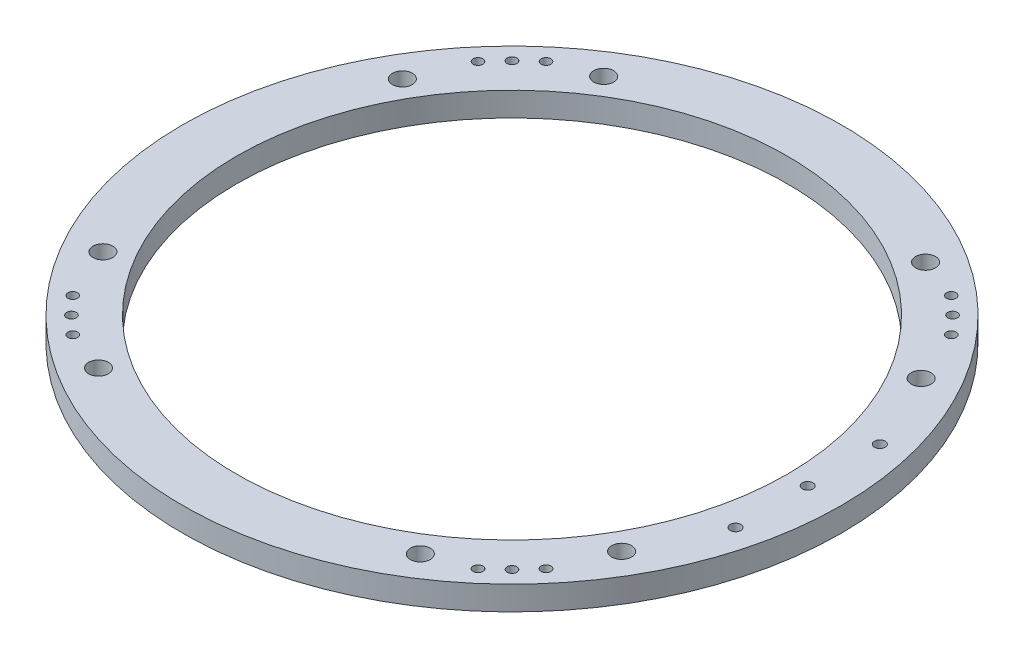
from build123d import *

# Parameters (mm, degrees)
F_1_4_20_TAPPED_HOLE1_D  = 5.1054
CIRPATTERN1_COUNT        = 4
F_10_CLEARANCE_HOLE1_D   = 5.6134
Z_0_413_DIAMETER_HOLE1_D = 10.4902


with BuildPart() as part:
    # Sketch1 → Revolve1 (revolve)
    with BuildSketch(Plane.XY):
        Polygon((145.526233777, 1064.895), (145.526233777, 1052.195), (152.4, 1052.195), (174.101233777, 1052.195), (174.101233777, 1064.895), align=None)
    revolve(axis=Axis((0, 1125.81516809, 0), (0, -1, 0)))

    # 1/4-20 Tapped Hole1 (through all)
    with Locations(Plane(origin=(0, 1052.195, 0), x_dir=(-1, 0, 0), z_dir=(0, -1, 0))):
        with Locations((107.045703742, 125.006215984), (125.006215984, 107.045703742), (116.372970926, 116.372970926)):
            f_1_4_20_tapped_hole1 = Hole(F_1_4_20_TAPPED_HOLE1_D / 2)

    # CirPattern1: 1/4-20 Tapped Hole1 ×4 about axis
    cirpattern1_axis = Axis((0, 1125.81516809, 0), (0, 1, 0))
    for i in range(1, CIRPATTERN1_COUNT):
        add(f_1_4_20_tapped_hole1.rotate(cirpattern1_axis, i * 360 / CIRPATTERN1_COUNT), mode=Mode.SUBTRACT)

    # #10 Clearance Hole1 (through all)
    with Locations(Plane(origin=(0, 1064.895, 0), x_dir=(1, 0, 0), z_dir=(0, 1, 0))):
        with Locations((156.21, 38.1), (156.21, 0), (156.21, -38.1)):
            Hole(F_10_CLEARANCE_HOLE1_D / 2)

    # Z (0.413) Diameter Hole1 (through all)
    with Locations(Plane(origin=(0, 1064.895, 0), x_dir=(1, 0, 0), z_dir=(0, 1, 0))):
        with Locations((-137.027937996, -79.113116888), (137.027937996, -79.113116888), (137.027937996, 79.113116888), (-137.027937996, 79.113116888), (-85.014893438, 133.44665207), (85.014893438, 133.44665207), (85.014893438, -133.44665207), (-85.014893438, -133.44665207)):
            Hole(Z_0_413_DIAMETER_HOLE1_D / 2)


solid = part.part
